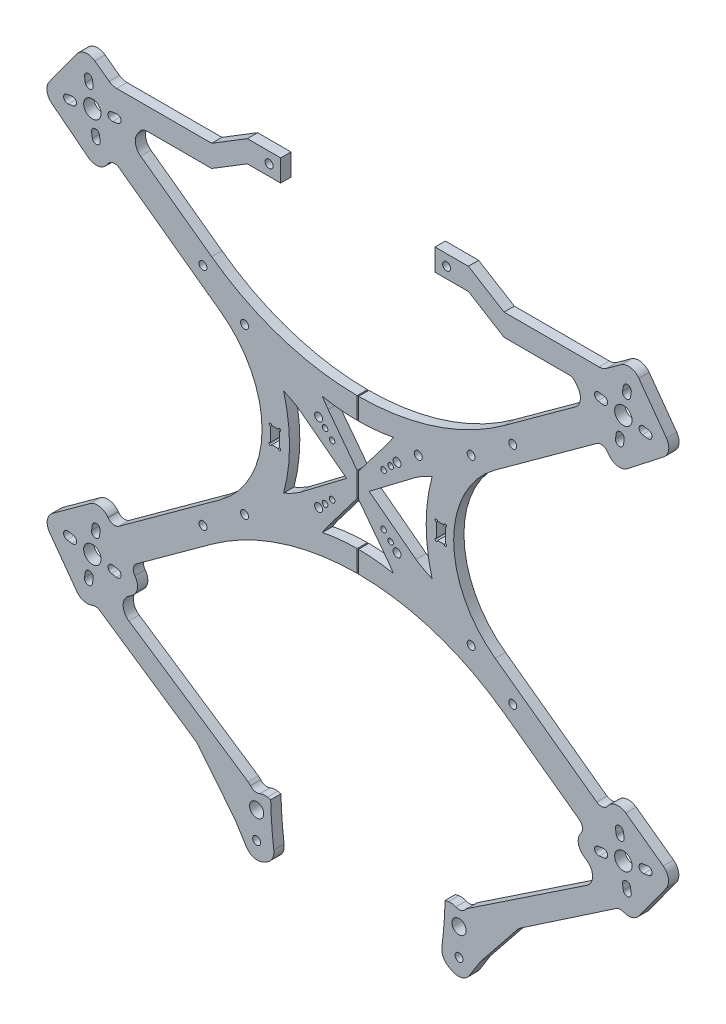
from build123d import *

# Parameters (mm, degrees)
SKETCH_7_R                   = 1.075
SKETCH_7_R_2                 = 1.55
EXTRUDE_2_5_DEPTH            = 4
CUT_EXTRUDE_4384_DEPTH       = 96.56387573
SKETCH_4456_R                = 3.375
SKETCH_4456_R_2              = 1.55
SKETCH_4456_R_3              = 2.75
EXTRUDE_8771_DEPTH           = 4
SKETCH_6862_R                = 1.55
SKETCH_6862_R_2              = 3.375
EXTRUDE_8910_DEPTH           = 4
SKETCH_8_W                   = 3.5
SKETCH_8_H                   = 6.5
CUT_EXTRUDE_3_DEPTH          = 192.931627997
PCB_2_R                      = 1.55
PCB_DEPTH                    = 192.931627997
FILLET_1_R                   = 5
FILLET_2_R                   = 3
SKETCH_11949_R               = 3.125
CUT_EXTRUDE_5_DEPTH          = 191.726245126
SKETCH_9_R                   = 0.5
CUT_EXTRUDE_12341_DEPTH      = 191.726245126
FILLET_12411_R               = 5
SPLIT_BODIES_1_OUTLINE_R     = 3.375
SPLIT_BODIES_1_OUTLINE_R_2   = 1.55
SPLIT_BODIES_1_OUTLINE_R_3   = 2.75
SPLIT_BODIES_1_OUTLINE_R_4   = 1.075
SPLIT_BODIES_1_DEPTH         = 4
SPLIT_BODIES_1_2_OUTLINE_R   = 3.375
SPLIT_BODIES_1_2_OUTLINE_R_2 = 1.55
SPLIT_BODIES_1_2_OUTLINE_R_3 = 2.75
SPLIT_BODIES_1_2_OUTLINE_R_4 = 1.075
SPLIT_BODIES_1_2_DEPTH       = 4


with BuildPart() as part:
    # 草图7 → 主结构-厚度还是得2.5, 不然铝柱不好选 (new body)
    with BuildSketch(Plane.XY):
        with BuildLine():
            Line((-67.360711622, -56.04781258), (-56.832820507, -48.398851956))
            ThreePointArc((-56.832820507, -48.398851956), (0, -29.93274918), (56.832820507, -48.398851956))
            Line((56.832820507, -48.398851956), (67.360711622, -56.04781258))
            ThreePointArc((67.360711622, -56.04781258), (75.39232454, -54.775730064), (74.120242023, -46.744117145))
            Line((74.120242023, -46.744117145), (53.395000648, -31.686347883))
            ThreePointArc((53.395000648, -31.686347883), (37.25, 0), (53.395000648, 31.686347883))
            Line((53.395000648, 31.686347883), (74.120242023, 46.744117145))
            ThreePointArc((74.120242023, 46.744117145), (75.39232454, 54.775730063), (67.360711622, 56.04781258))
            Line((67.360711622, 56.04781258), (56.832820507, 48.398851956))
            ThreePointArc((56.832820507, 48.398851956), (0, 29.93274918), (-56.832820507, 48.398851956))
            Line((-56.832820507, 48.398851956), (-67.360711622, 56.04781258))
            ThreePointArc((-67.360711622, 56.04781258), (-75.39232454, 54.775730063), (-74.120242023, 46.744117145))
            Line((-74.120242023, 46.744117145), (-53.395000648, 31.686347883))
            ThreePointArc((-53.395000648, 31.686347883), (-37.25, 0), (-53.395000648, -31.686347883))
            Line((-53.395000648, -31.686347883), (-74.120242023, -46.744117145))
            ThreePointArc((-74.120242023, -46.744117145), (-75.39232454, -54.775730064), (-67.360711622, -56.04781258))
        make_face()
        with Locations((10, 10)):
            Circle(SKETCH_7_R, mode=Mode.SUBTRACT)
        with Locations((12.75, 12.75)):
            Circle(SKETCH_7_R, mode=Mode.SUBTRACT)
        with Locations((15.25, 15.25)):
            Circle(SKETCH_7_R_2, mode=Mode.SUBTRACT)
        with Locations(Location((15.25, -15.25, 0), (0, 0, 180))):
            Circle(SKETCH_7_R_2, mode=Mode.SUBTRACT)
        with Locations(Location((12.75, -12.75, 0), (0, 0, 180))):
            Circle(SKETCH_7_R, mode=Mode.SUBTRACT)
        with Locations(Location((10, -10, 0), (0, 0, 180))):
            Circle(SKETCH_7_R, mode=Mode.SUBTRACT)
        with Locations(Location((60.224561343, 43.755705046, 0), (0, 0, 180))):
            Circle(SKETCH_7_R_2, mode=Mode.SUBTRACT)
        with Locations((-60.224561343, 43.755705046)):
            Circle(SKETCH_7_R_2, mode=Mode.SUBTRACT)
        with Locations((-10, -10)):
            Circle(SKETCH_7_R, mode=Mode.SUBTRACT)
        with Locations((-12.75, -12.75)):
            Circle(SKETCH_7_R, mode=Mode.SUBTRACT)
        with Locations((-15.25, -15.25)):
            Circle(SKETCH_7_R_2, mode=Mode.SUBTRACT)
        with Locations(Location((-15.25, 15.25, 0), (0, 0, 180))):
            Circle(SKETCH_7_R_2, mode=Mode.SUBTRACT)
        with Locations(Location((-12.75, 12.75, 0), (0, 0, 180))):
            Circle(SKETCH_7_R, mode=Mode.SUBTRACT)
        with Locations(Location((-10, 10, 0), (0, 0, 180))):
            Circle(SKETCH_7_R, mode=Mode.SUBTRACT)
        with Locations((60.224561343, -43.755705046)):
            Circle(SKETCH_7_R_2, mode=Mode.SUBTRACT)
        with Locations((44.044221455, -32)):
            Circle(SKETCH_7_R_2, mode=Mode.SUBTRACT)
        with Locations(Location((44.044221455, 32, 0), (0, 0, 180))):
            Circle(SKETCH_7_R_2, mode=Mode.SUBTRACT)
        with Locations((-44.044221455, 32)):
            Circle(SKETCH_7_R_2, mode=Mode.SUBTRACT)
        with Locations(Location((-60.224561343, -43.755705046, 0), (0, 0, 180))):
            Circle(SKETCH_7_R_2, mode=Mode.SUBTRACT)
        with Locations(Location((-44.044221455, -32, 0), (0, 0, 180))):
            Circle(SKETCH_7_R_2, mode=Mode.SUBTRACT)
    extrude(amount=EXTRUDE_2_5_DEPTH)

    # 草图6 → Cut-Extrude 4384 (cut, through all)
    with BuildSketch(Plane.XY):
        with BuildLine():
            Line((22.585858829, -13.811806674), (4.369879231, 0))
            Line((4.369879231, 0), (22.585858829, 13.811806674))
            ThreePointArc((22.585858829, 13.811806674), (25.637017076, 15.667901474), (28.86482634, 17.196267238))
            ThreePointArc((28.86482634, 17.196267238), (26.560773664, 0), (28.86482634, -17.196267238))
            ThreePointArc((28.86482634, -17.196267238), (25.637017076, -15.667901474), (22.585858829, -13.811806674))
        make_face()
        with BuildLine():
            Line((-22.585858829, 13.811806674), (-4.369879231, 0))
            Line((-4.369879231, 0), (-22.585858829, -13.811806674))
            ThreePointArc((-22.585858829, -13.811806674), (-25.637017076, -15.667901474), (-28.86482634, -17.196267238))
            ThreePointArc((-28.86482634, -17.196267238), (-26.560773664, 0), (-28.86482634, 17.196267238))
            ThreePointArc((-28.86482634, 17.196267238), (-25.637017076, 15.667901474), (-22.585858829, 13.811806674))
        make_face()
        with BuildLine():
            Line((-11.538849406, -19.588123327), (0, -4.369879231))
            Line((0, -4.369879231), (11.538849406, -19.588123327))
            ThreePointArc((11.538849406, -19.588123327), (12.705885919, -21.223769084), (13.776098615, -22.924344296))
            ThreePointArc((13.776098615, -22.924344296), (0, -21.563956437), (-13.776098615, -22.924344296))
            ThreePointArc((-13.776098615, -22.924344296), (-12.705885919, -21.223769084), (-11.538849406, -19.588123327))
        make_face()
        with BuildLine():
            Line((11.538849406, 19.588123327), (0, 4.369879231))
            Line((0, 4.369879231), (-11.538849406, 19.588123327))
            ThreePointArc((-11.538849406, 19.588123327), (-12.705885919, 21.223769084), (-13.776098615, 22.924344296))
            ThreePointArc((-13.776098615, 22.924344296), (0, 21.563956437), (13.776098615, 22.924344296))
            ThreePointArc((13.776098615, 22.924344296), (12.705885919, 21.223769084), (11.538849406, 19.588123327))
        make_face()
    extrude(amount=CUT_EXTRUDE_4384_DEPTH, mode=Mode.SUBTRACT)

    # Sketch 4456 → Extrude 8771 (add)
    # profile 1 of 2: a face of its own
    with BuildSketch(Plane.XY):
        with BuildLine():
            Line((41.719693225, -23.203740513), (95.282171315, -62.11915875))
            Line((95.282171315, -62.11915875), (100.131399646, -55.444768547))
            Line((100.131399646, -55.444768547), (122.783875489, -71.902755611))
            Line((122.783875489, -71.902755611), (106.325888424, -94.555231453))
            Line((106.325888424, -94.555231453), (101.962013194, -91.384690511))
            Line((101.962013194, -91.384690511), (62.537262972, -118.090865737))
            Line((62.537262972, -118.090865737), (47.651247851, -136.689513364))
            Line((47.651247851, -136.689513364), (40.869501648, -147.464808499))
            Line((40.869501648, -147.464808499), (35.510663468, -144.702808272))
            ThreePointArc((35.510663468, -144.702808272), (33.242094057, -142.452145099), (32.67537009, -139.307194251))
            ThreePointArc((32.67537009, -139.307194251), (33.501018596, -131.161165892), (33.898264993, -122.983044545))
            Line((33.898264993, -122.983044545), (42.671203749, -121.304684675))
            Line((42.671203749, -121.304684675), (94.999650503, -86.326237921))
            Line((94.999650503, -86.326237921), (83.673412582, -78.097244389))
            Line((83.673412582, -78.097244389), (88.522640913, -71.422854186))
            Line((88.522640913, -71.422854186), (34.960162823, -32.507435948))
            ThreePointArc((34.960162823, -32.507435948), (33.688080307, -24.47582303), (41.719693225, -23.203740513))
        make_face()
        with Locations(Location((103.228644035, -75, 0), (0, 0, 180))):
            Circle(SKETCH_4456_R, mode=Mode.SUBTRACT)
        with Locations((44.044221455, -32)):
            Circle(SKETCH_4456_R_2, mode=Mode.SUBTRACT)
        with Locations((60.224561343, -43.755705046)):
            Circle(SKETCH_4456_R_2, mode=Mode.SUBTRACT)
        with Locations(Location((39.335, -129.082300402, 0), (0, 0, 180))):
            Circle(SKETCH_4456_R_3, mode=Mode.SUBTRACT)
        with Locations(Location((39.335, -139.432300402, 0), (0, 0, 180))):
            Circle(SKETCH_4456_R_2, mode=Mode.SUBTRACT)
        with BuildLine():
            Line((110.640755254, -72.256715968), (112.616131935, -71.943847038))
            ThreePointArc((112.616131935, -71.943847038), (114.389522284, -73.232290545), (113.101078777, -75.005680894))
            Line((113.101078777, -75.005680894), (111.125702096, -75.318549824))
            ThreePointArc((111.125702096, -75.318549824), (109.352311747, -74.030106317), (110.640755254, -72.256715968))
        make_face(mode=Mode.SUBTRACT)
        with BuildLine():
            Line((103.547193859, -67.10294194), (103.234324929, -65.127565258))
            ThreePointArc((103.234324929, -65.127565258), (101.46093458, -63.839121751), (100.172491073, -65.6125121))
            Line((100.172491073, -65.6125121), (100.485360003, -67.587888781))
            ThreePointArc((100.485360003, -67.587888781), (102.258750352, -68.876332288), (103.547193859, -67.10294194))
        make_face(mode=Mode.SUBTRACT)
        with BuildLine():
            Line((95.816532817, -77.743284032), (93.841156135, -78.056152962))
            ThreePointArc((93.841156135, -78.056152962), (92.067765787, -76.767709455), (93.356209294, -74.994319106))
            Line((93.356209294, -74.994319106), (95.331585975, -74.681450176))
            ThreePointArc((95.331585975, -74.681450176), (97.104976324, -75.969893683), (95.816532817, -77.743284032))
        make_face(mode=Mode.SUBTRACT)
        with BuildLine():
            Line((102.910094211, -82.89705806), (103.222963142, -84.872434742))
            ThreePointArc((103.222963142, -84.872434742), (104.99635349, -86.160878249), (106.284796997, -84.3874879))
            Line((106.284796997, -84.3874879), (105.971928067, -82.412111219))
            ThreePointArc((105.971928067, -82.412111219), (104.198537719, -81.123667712), (102.910094211, -82.89705806))
        make_face(mode=Mode.SUBTRACT)
    # profile 2 of 2: a face of its own
    with BuildSketch(Plane.XY):
        with BuildLine():
            Line((-34.960162823, -32.507435948), (-88.522640913, -71.422854186))
            Line((-88.522640913, -71.422854186), (-83.673412582, -78.097244389))
            Line((-83.673412582, -78.097244389), (-94.999650503, -86.326237921))
            Line((-94.999650503, -86.326237921), (-42.671203749, -121.304684675))
            Line((-42.671203749, -121.304684675), (-33.898264993, -122.983044545))
            ThreePointArc((-33.898264993, -122.983044545), (-33.501018596, -131.161165892), (-32.67537009, -139.307194251))
            ThreePointArc((-32.67537009, -139.307194251), (-33.242094057, -142.452145099), (-35.510663468, -144.702808272))
            Line((-35.510663468, -144.702808272), (-40.869501648, -147.464808499))
            Line((-40.869501648, -147.464808499), (-47.651247851, -136.689513364))
            Line((-47.651247851, -136.689513364), (-62.537262972, -118.090865737))
            Line((-62.537262972, -118.090865737), (-101.962013194, -91.384690511))
            Line((-101.962013194, -91.384690511), (-106.325888424, -94.555231453))
            Line((-106.325888424, -94.555231453), (-122.783875489, -71.902755611))
            Line((-122.783875489, -71.902755611), (-100.131399646, -55.444768547))
            Line((-100.131399646, -55.444768547), (-95.282171315, -62.11915875))
            Line((-95.282171315, -62.11915875), (-41.719693225, -23.203740513))
            ThreePointArc((-41.719693225, -23.203740513), (-33.688080307, -24.47582303), (-34.960162823, -32.507435948))
        make_face()
        with Locations(Location((-44.044221455, -32, 0), (0, 0, 180.000000001))):
            Circle(SKETCH_4456_R_2, mode=Mode.SUBTRACT)
        with Locations(Location((-103.228644035, -75, 0), (0, 0, 180))):
            Circle(SKETCH_4456_R, mode=Mode.SUBTRACT)
        with Locations(Location((-39.335, -139.432300402, 0), (0, 0, 180))):
            Circle(SKETCH_4456_R_2, mode=Mode.SUBTRACT)
        with Locations(Location((-39.335, -129.082300402, 0), (0, 0, 180))):
            Circle(SKETCH_4456_R_3, mode=Mode.SUBTRACT)
        with Locations(Location((-60.224561343, -43.755705046, 0), (0, 0, 180.000000001))):
            Circle(SKETCH_4456_R_2, mode=Mode.SUBTRACT)
        with BuildLine():
            Line((-110.640755254, -72.256715968), (-112.616131935, -71.943847038))
            ThreePointArc((-112.616131935, -71.943847038), (-114.389522284, -73.232290545), (-113.101078777, -75.005680894))
            Line((-113.101078777, -75.005680894), (-111.125702096, -75.318549824))
            ThreePointArc((-111.125702096, -75.318549824), (-109.352311747, -74.030106317), (-110.640755254, -72.256715968))
        make_face(mode=Mode.SUBTRACT)
        with BuildLine():
            Line((-103.547193859, -67.10294194), (-103.234324929, -65.127565258))
            ThreePointArc((-103.234324929, -65.127565258), (-101.46093458, -63.839121751), (-100.172491073, -65.6125121))
            Line((-100.172491073, -65.6125121), (-100.485360003, -67.587888781))
            ThreePointArc((-100.485360003, -67.587888781), (-102.258750352, -68.876332288), (-103.547193859, -67.10294194))
        make_face(mode=Mode.SUBTRACT)
        with BuildLine():
            Line((-95.816532817, -77.743284032), (-93.841156135, -78.056152962))
            ThreePointArc((-93.841156135, -78.056152962), (-92.067765787, -76.767709455), (-93.356209294, -74.994319106))
            Line((-93.356209294, -74.994319106), (-95.331585975, -74.681450176))
            ThreePointArc((-95.331585975, -74.681450176), (-97.104976324, -75.969893683), (-95.816532817, -77.743284032))
        make_face(mode=Mode.SUBTRACT)
        with BuildLine():
            Line((-102.910094211, -82.89705806), (-103.222963142, -84.872434742))
            ThreePointArc((-103.222963142, -84.872434742), (-104.99635349, -86.160878249), (-106.284796997, -84.3874879))
            Line((-106.284796997, -84.3874879), (-105.971928067, -82.412111219))
            ThreePointArc((-105.971928067, -82.412111219), (-104.198537719, -81.123667712), (-102.910094211, -82.89705806))
        make_face(mode=Mode.SUBTRACT)
    extrude(amount=EXTRUDE_8771_DEPTH)

    # Sketch 6862 → Extrude 8910 (add)
    # profile 1 of 2: a face of its own
    with BuildSketch(Plane.XY):
        with BuildLine():
            Line((30, 95.097244389), (42.973762785, 95.097244389))
            Line((42.973762785, 95.097244389), (56.836706291, 86.597244389))
            Line((56.836706291, 86.597244389), (95.372658906, 86.597244389))
            Line((95.372658906, 86.597244389), (106.325888424, 94.555231453))
            Line((106.325888424, 94.555231453), (122.769420633, 71.892260587))
            Line((122.769420633, 71.892260587), (100.719184898, 54.635751552))
            Line((100.719184898, 54.635751552), (95.282171315, 62.11915875))
            Line((95.282171315, 62.11915875), (41.719693225, 23.203740513))
            ThreePointArc((41.719693225, 23.203740513), (33.688080307, 24.47582303), (34.960162823, 32.507435948))
            Line((34.960162823, 32.507435948), (88.522640913, 71.422854186))
            Line((88.522640913, 71.422854186), (83.673412582, 78.097244389))
            Line((83.673412582, 78.097244389), (56.836706291, 78.097244389))
            Line((56.836706291, 78.097244389), (42.973762785, 86.597244389))
            Line((42.973762785, 86.597244389), (30, 86.597244389))
            Line((30, 86.597244389), (30, 95.097244389))
        make_face()
        with Locations(Location((34.5, 90.85, 0), (0, 0, 180))):
            Circle(SKETCH_6862_R, mode=Mode.SUBTRACT)
        with Locations(Location((60.224561343, 43.755705046, 0), (0, 0, 180))):
            Circle(SKETCH_6862_R, mode=Mode.SUBTRACT)
        with Locations(Location((44.044221455, 32, 0), (0, 0, 180))):
            Circle(SKETCH_6862_R, mode=Mode.SUBTRACT)
        with Locations(Location((103.228644035, 75, 0), (0, 0, 180))):
            Circle(SKETCH_6862_R_2, mode=Mode.SUBTRACT)
        with BuildLine():
            Line((110.640755254, 72.256715968), (112.616131935, 71.943847038))
            ThreePointArc((112.616131935, 71.943847038), (114.389522284, 73.232290545), (113.101078777, 75.005680894))
            Line((113.101078777, 75.005680894), (111.125702096, 75.318549824))
            ThreePointArc((111.125702096, 75.318549824), (109.352311747, 74.030106317), (110.640755254, 72.256715968))
        make_face(mode=Mode.SUBTRACT)
        with BuildLine():
            Line((103.547193859, 67.10294194), (103.234324929, 65.127565258))
            ThreePointArc((103.234324929, 65.127565258), (101.46093458, 63.839121751), (100.172491073, 65.6125121))
            Line((100.172491073, 65.6125121), (100.485360003, 67.587888781))
            ThreePointArc((100.485360003, 67.587888781), (102.258750352, 68.876332288), (103.547193859, 67.10294194))
        make_face(mode=Mode.SUBTRACT)
        with BuildLine():
            Line((95.816532817, 77.743284032), (93.841156135, 78.056152962))
            ThreePointArc((93.841156135, 78.056152962), (92.067765787, 76.767709455), (93.356209294, 74.994319106))
            Line((93.356209294, 74.994319106), (95.331585975, 74.681450176))
            ThreePointArc((95.331585975, 74.681450176), (97.104976324, 75.969893683), (95.816532817, 77.743284032))
        make_face(mode=Mode.SUBTRACT)
        with BuildLine():
            Line((102.910094211, 82.89705806), (103.222963142, 84.872434742))
            ThreePointArc((103.222963142, 84.872434742), (104.99635349, 86.160878249), (106.284796997, 84.3874879))
            Line((106.284796997, 84.3874879), (105.971928067, 82.412111219))
            ThreePointArc((105.971928067, 82.412111219), (104.198537719, 81.123667712), (102.910094211, 82.89705806))
        make_face(mode=Mode.SUBTRACT)
    # profile 2 of 2: a face of its own
    with BuildSketch(Plane.XY):
        with BuildLine():
            Line((-41.719693225, 23.203740513), (-95.282171315, 62.11915875))
            Line((-95.282171315, 62.11915875), (-100.719184898, 54.635751552))
            Line((-100.719184898, 54.635751552), (-122.769420633, 71.892260587))
            Line((-122.769420633, 71.892260587), (-106.325888424, 94.555231453))
            Line((-106.325888424, 94.555231453), (-95.372658906, 86.597244389))
            Line((-95.372658906, 86.597244389), (-56.836706291, 86.597244389))
            Line((-56.836706291, 86.597244389), (-42.973762785, 95.097244389))
            Line((-42.973762785, 95.097244389), (-30, 95.097244389))
            Line((-30, 95.097244389), (-30, 86.597244389))
            Line((-30, 86.597244389), (-42.973762785, 86.597244389))
            Line((-42.973762785, 86.597244389), (-56.836706291, 78.097244389))
            Line((-56.836706291, 78.097244389), (-83.673412582, 78.097244389))
            Line((-83.673412582, 78.097244389), (-88.522640913, 71.422854186))
            Line((-88.522640913, 71.422854186), (-34.960162823, 32.507435948))
            ThreePointArc((-34.960162823, 32.507435948), (-33.688080307, 24.47582303), (-41.719693225, 23.203740513))
        make_face()
        with Locations(Location((-103.228644035, 75, 0), (0, 0, 180))):
            Circle(SKETCH_6862_R_2, mode=Mode.SUBTRACT)
        with Locations((-44.044221455, 32)):
            Circle(SKETCH_6862_R, mode=Mode.SUBTRACT)
        with Locations((-60.224561343, 43.755705046)):
            Circle(SKETCH_6862_R, mode=Mode.SUBTRACT)
        with Locations(Location((-34.5, 90.85, 0), (0, 0, 180))):
            Circle(SKETCH_6862_R, mode=Mode.SUBTRACT)
        with BuildLine():
            Line((-110.640755254, 72.256715968), (-112.616131935, 71.943847038))
            ThreePointArc((-112.616131935, 71.943847038), (-114.389522284, 73.232290545), (-113.101078777, 75.005680894))
            Line((-113.101078777, 75.005680894), (-111.125702096, 75.318549824))
            ThreePointArc((-111.125702096, 75.318549824), (-109.352311747, 74.030106317), (-110.640755254, 72.256715968))
        make_face(mode=Mode.SUBTRACT)
        with BuildLine():
            Line((-103.547193859, 67.10294194), (-103.234324929, 65.127565258))
            ThreePointArc((-103.234324929, 65.127565258), (-101.46093458, 63.839121751), (-100.172491073, 65.6125121))
            Line((-100.172491073, 65.6125121), (-100.485360003, 67.587888781))
            ThreePointArc((-100.485360003, 67.587888781), (-102.258750352, 68.876332288), (-103.547193859, 67.10294194))
        make_face(mode=Mode.SUBTRACT)
        with BuildLine():
            Line((-95.816532817, 77.743284032), (-93.841156135, 78.056152962))
            ThreePointArc((-93.841156135, 78.056152962), (-92.067765787, 76.767709455), (-93.356209294, 74.994319106))
            Line((-93.356209294, 74.994319106), (-95.331585975, 74.681450176))
            ThreePointArc((-95.331585975, 74.681450176), (-97.104976324, 75.969893683), (-95.816532817, 77.743284032))
        make_face(mode=Mode.SUBTRACT)
        with BuildLine():
            Line((-102.910094211, 82.89705806), (-103.222963142, 84.872434742))
            ThreePointArc((-103.222963142, 84.872434742), (-104.99635349, 86.160878249), (-106.284796997, 84.3874879))
            Line((-106.284796997, 84.3874879), (-105.971928067, 82.412111219))
            ThreePointArc((-105.971928067, 82.412111219), (-104.198537719, 81.123667712), (-102.910094211, 82.89705806))
        make_face(mode=Mode.SUBTRACT)
    extrude(amount=EXTRUDE_8910_DEPTH)

    # 草图8 → 切除-拉伸3 (cut, through all)
    with BuildSketch(Plane.XY):
        with Locations((32.25, 0)):
            Rectangle(SKETCH_8_W, SKETCH_8_H)
        with Locations((-32.25, 0)):
            Rectangle(SKETCH_8_W, SKETCH_8_H)
    extrude(amount=CUT_EXTRUDE_3_DEPTH, mode=Mode.SUBTRACT)

    # PCB 2 → PCB (cut, through all)
    with BuildSketch(Plane.XY):
        with Locations((23.5, 21.71275604)):
            Circle(PCB_2_R)
    extrude(amount=PCB_DEPTH, mode=Mode.SUBTRACT)

    # 电机座圆角-1
    fillet_1_edges = [part.edges().sort_by_distance(p)[0] for p in [
        (94.999650503, -86.326237921, 2),
        (83.673412582, -78.097244389, 2),
        (100.131399646, -55.444768547, 2),
        (122.783875489, -71.902755611, 2),
        (106.325888424, -94.555231453, 2),
        (-106.325888424, -94.555231453, 2),
        (-122.783875489, -71.902755611, 2),
        (-100.131399646, -55.444768547, 2),
        (-83.673412582, -78.097244389, 2),
        (-94.999650503, -86.326237921, 2),
        (-88.522640913, 71.422854186, 2),
        (-100.719184898, 54.635751552, 2),
        (-122.769420633, 71.892260587, 2),
        (-106.325888424, 94.555231453, 2),
        (-95.372658906, 86.597244389, 2),
        (88.522640913, 71.422854186, 2),
        (95.372658906, 86.597244389, 2),
        (106.325888424, 94.555231453, 2),
        (122.769420633, 71.892260587, 2),
        (100.719184898, 54.635751552, 2),
    ]]
    fillet(fillet_1_edges, radius=FILLET_1_R)

    # 电机座圆角-2
    fillet_2_edges = [part.edges().sort_by_distance(p)[0] for p in [
        (95.282171315, 62.11915875, 2),
        (83.673412582, 78.097244389, 2),
        (-83.673412582, 78.097244389, 2),
        (-95.282171315, 62.11915875, 2),
        (-88.522640913, -71.422854186, 2),
        (-95.282171315, -62.11915875, 2),
        (95.282171315, -62.11915875, 2),
        (88.522640913, -71.422854186, 2),
        (101.962013194, -91.384690511, 2),
        (-101.962013194, -91.384690511, 2),
    ]]
    fillet(fillet_2_edges, radius=FILLET_2_R)

    # Sketch 11949 → 切除-拉伸5 (cut, through all)
    with BuildSketch(Plane.XY):
        with Locations((39.335, -120.182300402)):
            Circle(SKETCH_11949_R)
        with Locations((-39.335, -120.182300402)):
            Circle(SKETCH_11949_R)
    extrude(amount=CUT_EXTRUDE_5_DEPTH, mode=Mode.SUBTRACT)

    # 草图9 → Cut-Extrude 12341 (cut, through all)
    with BuildSketch(Plane.XY.offset(4)):
        with Locations((-34, 3.25)):
            Circle(SKETCH_9_R)
        with Locations((-30.5, 3.25)):
            Circle(SKETCH_9_R)
        with Locations((-30.5, -3.25)):
            Circle(SKETCH_9_R)
        with Locations((-34, -3.25)):
            Circle(SKETCH_9_R)
        with Locations((34, -3.25)):
            Circle(SKETCH_9_R)
        with Locations((30.5, -3.25)):
            Circle(SKETCH_9_R)
        with Locations((30.5, 3.25)):
            Circle(SKETCH_9_R)
        with Locations((34, 3.25)):
            Circle(SKETCH_9_R)
    extrude(amount=-CUT_EXTRUDE_12341_DEPTH, mode=Mode.SUBTRACT)

    # Fillet 12411
    # the kernel refuses this fillet: 5 mm, written as the material it adds along each edge
    with BuildSketch(Plane(origin=(62.537262972, -118.090865737, 0), x_dir=(0.8279275993780559, 0.5608349937263982, 0), z_dir=(0, 0, 1)), Plane(origin=(-62.537262972, -118.090865737, 0), x_dir=(0.6248766859136476, -0.7807234641033767, 0), z_dir=(0, 0, 1))) as fillet_12411_piece_1:
        with BuildLine():
            CenterArc((FILLET_12411_R * 0.151354502876, -FILLET_12411_R), FILLET_12411_R, 90, 17.21330009)
            Line((-FILLET_12411_R * 0.144575288313, -FILLET_12411_R * 0.0447903064317), (0, 0))
            Line((0, 0), (FILLET_12411_R * 0.151354502876, 0))
        make_face()
    extrude(amount=4)
    with BuildSketch(Plane(origin=(47.651247851, -136.689513364, 0), x_dir=(0.6248766859136319, 0.7807234641033892, 0), z_dir=(0, 0, 1)), Plane(origin=(-47.651247851, -136.689513364, 0), x_dir=(0.5326614605326793, -0.8463284046179669, 0), z_dir=(0, 0, 1))) as fillet_12411_piece_2:
        with BuildLine():
            CenterArc((FILLET_12411_R * 0.0566762665368, -FILLET_12411_R), FILLET_12411_R, 90, 6.487681108)
            Line((-FILLET_12411_R * 0.0563133214739, -FILLET_12411_R * 0.00640382800599), (0, 0))
            Line((0, 0), (FILLET_12411_R * 0.0566762665369, 0))
        make_face()
    extrude(amount=4)
    # the kernel refuses this fillet: 5 mm, written as the material it takes off along each edge
    with BuildSketch(Plane(origin=(40.869501648, -147.464808499, -11.470523002), x_dir=(-0.8888809016376404, 0.4581383445028971, 0), z_dir=(0, 0, 1)), Plane(origin=(-40.869501648, -147.464808499, -11.470523002), x_dir=(-0.532661460532709, 0.846328404617948, 0), z_dir=(0, 0, 1))) as fillet_12411_2_piece_1:
        with BuildLine():
            CenterArc((FILLET_12411_R * 0.917641840184, -FILLET_12411_R), FILLET_12411_R, 90, 85.081587379)
            Line((-FILLET_12411_R * 0.0786759549038, -FILLET_12411_R * 0.914262894892), (0, 0))
            Line((0, 0), (FILLET_12411_R * 0.917641840184, 0))
        make_face()
    extrude(amount=26.941046005, mode=Mode.SUBTRACT)
    with BuildSketch(Plane(origin=(-37.103373722, -122.369871922, 8.875913591), x_dir=(0.982187532988923, -0.18790329970794328, 0), z_dir=(0, 0, -1))) as fillet_12411_2_piece_2:
        with BuildLine():
            CenterArc((1.950365437, 5), FILLET_12411_R, 235.916170221, 34.083829779)
            ThreePointArc((-0.851660934, 0.858907364), (-0.383877712, 0.47105249), (0, 0))
            Line((0, 0), (1.950365437, 0))
        make_face()
    extrude(amount=13.751827183, mode=Mode.SUBTRACT)
    with BuildSketch(Plane(origin=(-42.216499435, -121.391674622, 6.283952619), x_dir=(0.5176261480644923, -0.8556069020525234, 0), z_dir=(0, 0, -1))) as fillet_12411_2_piece_3:
        with BuildLine():
            CenterArc((1.644445885, 4.946295239), FILLET_12411_R, 246.992701284, 14.602089673)
            Line((-0.309796041, 0.344019878), (0, 0))
            ThreePointArc((0, 0), (0.456790524, 0.033565476), (0.913581047, 0))
        make_face()
    extrude(amount=8.567905237, mode=Mode.SUBTRACT)
    with BuildSketch(Plane(origin=(42.216499435, -121.391674622, 6.283952619), x_dir=(0.9821875329889277, 0.1879032997079196, 0), z_dir=(0, 0, -1))) as fillet_12411_2_piece_4:
        with BuildLine():
            CenterArc((2.575179825, 4.531940834), FILLET_12411_R, 230.408809917, 14.602089674)
            ThreePointArc((-0.611347707, 0.678884608), (-0.280731256, 0.361903559), (0, 0))
            Line((0, 0), (0.462950606, 0))
        make_face()
    extrude(amount=8.567905238, mode=Mode.SUBTRACT)
    with BuildSketch(Plane(origin=(37.103373722, -122.369871922, 8.875913591), x_dir=(0.8249924848100602, -0.5651436985465933, 0), z_dir=(0, 0, -1))) as fillet_12411_2_piece_5:
        with BuildLine():
            CenterArc((2.177217533, 4.905471348), FILLET_12411_R, 224.757281026, 34.083829779)
            Line((-1.373261993, 1.38494651), (0, 0))
            ThreePointArc((0, 0), (0.604782648, 0.059080407), (1.209565296, 0))
        make_face()
    extrude(amount=13.751827183, mode=Mode.SUBTRACT)

    # Split Bodies 1 2 outline → Split Bodies 1 2 (cut)
    with BuildSketch(Plane.XY):
        with BuildLine():
            ThreePointArc((-56.832820507, -48.398851956), (-29.759874798, -34.626533022), (0.25, -29.933072379))
            Line((0.25, -29.933072379), (0.25, -21.564400124))
            ThreePointArc((0.25, -21.564400124), (-6.797146311, -21.892704882), (-13.776098615, -22.924344296))
            ThreePointArc((-13.776098615, -22.924344296), (-12.705885919, -21.223769084), (-11.538849406, -19.588123327))
            Line((-11.538849406, -19.588123327), (0, -4.369879231))
            Line((0, -4.369879231), (0.25, -4.69959677))
            Line((0.25, -4.69959677), (0.25, 4.69959677))
            Line((0.25, 4.69959677), (0, 4.369879231))
            Line((0, 4.369879231), (-11.538849406, 19.588123327))
            ThreePointArc((-11.538849406, 19.588123327), (-12.705885919, 21.223769084), (-13.776098615, 22.924344296))
            ThreePointArc((-13.776098615, 22.924344296), (-6.797146311, 21.892704882), (0.25, 21.564400124))
            Line((0.25, 21.564400124), (0.25, 29.933072379))
            ThreePointArc((0.25, 29.933072379), (-29.759874798, 34.626533022), (-56.832820507, 48.398851956))
            Line((-56.832820507, 48.398851956), (-84.477555942, 68.483927924))
            ThreePointArc((-84.477555942, 68.483927924), (-86.477071383, 71.746840571), (-85.583714652, 75.467939157))
            Line((-85.583714652, 75.467939157), (-84.571887217, 76.860600146))
            ThreePointArc((-84.571887217, 76.860600146), (-83.506807733, 77.770263962), (-82.144836234, 78.097244389))
            Line((-82.144836234, 78.097244389), (-56.836706291, 78.097244389))
            Line((-56.836706291, 78.097244389), (-42.973762785, 86.597244389))
            Line((-42.973762785, 86.597244389), (-30, 86.597244389))
            Line((-30, 86.597244389), (-30, 95.097244389))
            Line((-30, 95.097244389), (-42.973762785, 95.097244389))
            Line((-42.973762785, 95.097244389), (-56.836706291, 86.597244389))
            Line((-56.836706291, 86.597244389), (-93.748060425, 86.597244389))
            ThreePointArc((-93.748060425, 86.597244389), (-95.293145397, 86.841961808), (-96.686986686, 87.552159417))
            Line((-96.686986686, 87.552159417), (-102.278222003, 91.614429659))
            ThreePointArc((-102.278222003, 91.614429659), (-106.000895829, 92.507536639), (-109.264107348, 90.505689724))
            Line((-109.264107348, 90.505689724), (-119.937946256, 75.79468377))
            ThreePointArc((-119.937946256, 75.79468377), (-120.842389268, 72.162912749), (-118.972506644, 68.920796637))
            Line((-118.972506644, 68.920796637), (-104.799957692, 57.829363332))
            ThreePointArc((-104.799957692, 57.829363332), (-101.024591686, 56.815281756), (-97.67335325, 58.827979166))
            Line((-97.67335325, 58.827979166), (-97.045527072, 59.692107767))
            ThreePointArc((-97.045527072, 59.692107767), (-95.087779484, 60.891817032), (-92.855120332, 60.355802993))
            Line((-92.855120332, 60.355802993), (-53.395000648, 31.686347883))
            ThreePointArc((-53.395000648, 31.686347883), (-37.25, 0), (-53.395000648, -31.686347883))
            Line((-53.395000648, -31.686347883), (-92.855120332, -60.355802993))
            ThreePointArc((-92.855120332, -60.355802993), (-95.087779484, -60.891817032), (-97.045527072, -59.692107767))
            Line((-97.045527072, -59.692107767), (-97.192473385, -59.489853519))
            ThreePointArc((-97.192473385, -59.489853519), (-100.455386031, -57.490338077), (-104.176484618, -58.383694808))
            Line((-104.176484618, -58.383694808), (-118.738790517, -68.963829349))
            ThreePointArc((-118.738790517, -68.963829349), (-120.738305958, -72.226741996), (-119.844949227, -75.947840583))
            Line((-119.844949227, -75.947840583), (-109.264814686, -90.510146481))
            ThreePointArc((-109.264814686, -90.510146481), (-106.551058018, -92.390718632), (-103.256787526, -92.169791516))
            ThreePointArc((-103.256787526, -92.169791516), (-101.791539496, -91.942740448), (-100.396517233, -92.445151496))
            Line((-100.396517233, -92.445151496), (-63.163815823, -117.666441229))
            ThreePointArc((-63.163815823, -117.666441229), (-62.575896334, -118.132702687), (-62.064373471, -118.681695796))
            Line((-62.064373471, -118.681695796), (-47.828326239, -136.468270909))
            ThreePointArc((-47.828326239, -136.468270909), (-47.657786107, -136.694164895), (-47.500301536, -136.929347035))
            Line((-47.500301536, -136.929347035), (-43.313463863, -143.581676726))
            ThreePointArc((-43.313463863, -143.581676726), (-40.398977423, -145.741760468), (-36.791130117, -145.362773931))
            Line((-36.791130117, -145.362773931), (-35.510663468, -144.702808272))
            ThreePointArc((-35.510663468, -144.702808272), (-33.242094057, -142.452145099), (-32.67537009, -139.307194251))
            ThreePointArc((-32.67537009, -139.307194251), (-33.501018596, -131.161165892), (-33.898264993, -122.983044545))
            Line((-33.898264993, -122.983044545), (-35.187749106, -122.736352023))
            ThreePointArc((-35.187749106, -122.736352023), (-36.668257161, -122.676643037), (-38.101256002, -123.053450127))
            ThreePointArc((-38.101256002, -123.053450127), (-40.068977694, -123.219881964), (-41.743605997, -122.173340872))
            ThreePointArc((-41.743605997, -122.173340872), (-42.179694745, -121.70942241), (-42.671203749, -121.304684675))
            Line((-42.671203749, -121.304684675), (-89.036558216, -90.312209587))
            ThreePointArc((-89.036558216, -90.312209587), (-91.256999969, -86.253080414), (-89.196881168, -82.110279219))
            Line((-89.196881168, -82.110279219), (-87.718497554, -81.036170651))
            ThreePointArc((-87.718497554, -81.036170651), (-85.718982112, -77.773258004), (-86.612338843, -74.052159417))
            Line((-86.612338843, -74.052159417), (-86.759285157, -73.849905169))
            ThreePointArc((-86.759285157, -73.849905169), (-87.295299195, -71.617246017), (-86.09558993, -69.659498429))
            Line((-86.09558993, -69.659498429), (-56.832820507, -48.398851956))
        make_face()
        with BuildLine():
            ThreePointArc((-110.640755254, -72.256715968), (-109.352311747, -74.030106317), (-111.125702096, -75.318549824))
            Line((-111.125702096, -75.318549824), (-113.101078777, -75.005680894))
            ThreePointArc((-113.101078777, -75.005680894), (-114.389522284, -73.232290545), (-112.616131935, -71.943847038))
            Line((-112.616131935, -71.943847038), (-110.640755254, -72.256715968))
        make_face(mode=Mode.SUBTRACT)
        with BuildLine():
            Line((-102.910094211, -82.89705806), (-103.222963142, -84.872434742))
            ThreePointArc((-103.222963142, -84.872434742), (-104.996353491, -86.160878249), (-106.284796997, -84.3874879))
            Line((-106.284796997, -84.3874879), (-105.971928067, -82.412111219))
            ThreePointArc((-105.971928067, -82.412111219), (-104.198537719, -81.123667712), (-102.910094211, -82.89705806))
        make_face(mode=Mode.SUBTRACT)
        with Locations((-103.228644035, -75)):
            Circle(SPLIT_BODIES_1_2_OUTLINE_R, mode=Mode.SUBTRACT)
        with BuildLine():
            Line((-95.331585975, -74.681450176), (-93.356209294, -74.994319106))
            ThreePointArc((-93.356209294, -74.994319106), (-92.067765787, -76.767709454), (-93.841156135, -78.056152962))
            Line((-93.841156135, -78.056152962), (-95.816532817, -77.743284032))
            ThreePointArc((-95.816532817, -77.743284032), (-97.104976324, -75.969893683), (-95.331585975, -74.681450176))
        make_face(mode=Mode.SUBTRACT)
        with BuildLine():
            ThreePointArc((-100.485360003, -67.587888781), (-102.258750351, -68.876332288), (-103.547193859, -67.10294194))
            Line((-103.547193859, -67.10294194), (-103.234324929, -65.127565258))
            ThreePointArc((-103.234324929, -65.127565258), (-101.46093458, -63.839121751), (-100.172491073, -65.6125121))
            Line((-100.172491073, -65.6125121), (-100.485360003, -67.587888781))
        make_face(mode=Mode.SUBTRACT)
        with Locations((-39.335, -139.432300402)):
            Circle(SPLIT_BODIES_1_2_OUTLINE_R_2, mode=Mode.SUBTRACT)
        with Locations((-39.335, -129.082300402)):
            Circle(SPLIT_BODIES_1_2_OUTLINE_R_3, mode=Mode.SUBTRACT)
        with Locations((-60.224561343, -43.755705046)):
            Circle(SPLIT_BODIES_1_2_OUTLINE_R_2, mode=Mode.SUBTRACT)
        with Locations((-44.044221455, -32)):
            Circle(SPLIT_BODIES_1_2_OUTLINE_R_2, mode=Mode.SUBTRACT)
        with BuildLine():
            ThreePointArc((-111.125702096, 75.318549824), (-109.352311747, 74.030106317), (-110.640755254, 72.256715968))
            Line((-110.640755254, 72.256715968), (-112.616131935, 71.943847038))
            ThreePointArc((-112.616131935, 71.943847038), (-114.389522284, 73.232290545), (-113.101078777, 75.005680894))
            Line((-113.101078777, 75.005680894), (-111.125702096, 75.318549824))
        make_face(mode=Mode.SUBTRACT)
        with BuildLine():
            ThreePointArc((-103.547193859, 67.10294194), (-102.258750351, 68.876332288), (-100.485360003, 67.587888781))
            Line((-100.485360003, 67.587888781), (-100.172491073, 65.6125121))
            ThreePointArc((-100.172491073, 65.6125121), (-101.46093458, 63.839121751), (-103.234324929, 65.127565258))
            Line((-103.234324929, 65.127565258), (-103.547193859, 67.10294194))
        make_face(mode=Mode.SUBTRACT)
        with Locations((-103.228644035, 75)):
            Circle(SPLIT_BODIES_1_2_OUTLINE_R, mode=Mode.SUBTRACT)
        with BuildLine():
            Line((-95.816532817, 77.743284032), (-93.841156135, 78.056152962))
            ThreePointArc((-93.841156135, 78.056152962), (-92.067765787, 76.767709454), (-93.356209294, 74.994319106))
            Line((-93.356209294, 74.994319106), (-95.331585975, 74.681450176))
            ThreePointArc((-95.331585975, 74.681450176), (-97.104976324, 75.969893683), (-95.816532817, 77.743284032))
        make_face(mode=Mode.SUBTRACT)
        with BuildLine():
            Line((-105.971928067, 82.412111219), (-106.284796997, 84.3874879))
            ThreePointArc((-106.284796997, 84.3874879), (-104.996353491, 86.160878249), (-103.222963142, 84.872434742))
            Line((-103.222963142, 84.872434742), (-102.910094211, 82.89705806))
            ThreePointArc((-102.910094211, 82.89705806), (-104.198537719, 81.123667712), (-105.971928067, 82.412111219))
        make_face(mode=Mode.SUBTRACT)
        with BuildLine():
            ThreePointArc((-34, 2.75), (-34.353553391, 3.603553391), (-33.5, 3.25))
            Line((-33.5, 3.25), (-31, 3.25))
            ThreePointArc((-31, 3.25), (-30.146446609, 3.603553391), (-30.5, 2.75))
            Line((-30.5, 2.75), (-30.5, -2.75))
            ThreePointArc((-30.5, -2.75), (-30.146446609, -3.603553391), (-31, -3.25))
            Line((-31, -3.25), (-33.5, -3.25))
            ThreePointArc((-33.5, -3.25), (-34.353553391, -3.603553391), (-34, -2.75))
            Line((-34, -2.75), (-34, 2.75))
        make_face(mode=Mode.SUBTRACT)
        with Locations((-44.044221455, 32)):
            Circle(SPLIT_BODIES_1_2_OUTLINE_R_2, mode=Mode.SUBTRACT)
        with Locations((-15.25, -15.25)):
            Circle(SPLIT_BODIES_1_2_OUTLINE_R_2, mode=Mode.SUBTRACT)
        with BuildLine():
            Line((-22.585858829, 13.811806674), (-4.369879231, 0))
            Line((-4.369879231, 0), (-22.585858829, -13.811806674))
            ThreePointArc((-22.585858829, -13.811806674), (-25.637017076, -15.667901474), (-28.86482634, -17.196267238))
            ThreePointArc((-28.86482634, -17.196267238), (-26.560773664, 0), (-28.86482634, 17.196267238))
            ThreePointArc((-28.86482634, 17.196267238), (-25.637017076, 15.667901474), (-22.585858829, 13.811806674))
        make_face(mode=Mode.SUBTRACT)
        with Locations((-12.75, -12.75)):
            Circle(SPLIT_BODIES_1_2_OUTLINE_R_4, mode=Mode.SUBTRACT)
        with Locations((-10, -10)):
            Circle(SPLIT_BODIES_1_2_OUTLINE_R_4, mode=Mode.SUBTRACT)
        with Locations((-15.25, 15.25)):
            Circle(SPLIT_BODIES_1_2_OUTLINE_R_2, mode=Mode.SUBTRACT)
        with Locations((-10, 10)):
            Circle(SPLIT_BODIES_1_2_OUTLINE_R_4, mode=Mode.SUBTRACT)
        with Locations((-12.75, 12.75)):
            Circle(SPLIT_BODIES_1_2_OUTLINE_R_4, mode=Mode.SUBTRACT)
        with Locations((-60.224561343, 43.755705046)):
            Circle(SPLIT_BODIES_1_2_OUTLINE_R_2, mode=Mode.SUBTRACT)
        with Locations((-34.5, 90.85)):
            Circle(SPLIT_BODIES_1_2_OUTLINE_R_2, mode=Mode.SUBTRACT)
    extrude(amount=SPLIT_BODIES_1_2_DEPTH, mode=Mode.SUBTRACT)


with BuildPart() as body_2:
    # Split Bodies 1: read off the stored shape, not the designer's step
    # Split Bodies 1 outline → Split Bodies 1 (new body)
    with BuildSketch(Plane.XY):
        with BuildLine():
            ThreePointArc((-56.832820507, -48.398851956), (-29.997639125, -34.703787336), (-0.25, -29.93307238))
            Line((-0.25, -29.93307238), (-0.25, -21.564400124))
            ThreePointArc((-0.25, -21.564400124), (-7.045936604, -21.917272889), (-13.776098615, -22.924344296))
            ThreePointArc((-13.776098615, -22.924344296), (-12.705885919, -21.223769084), (-11.538849406, -19.588123327))
            Line((-11.538849406, -19.588123327), (-0.25, -4.69959677))
            Line((-0.25, -4.69959677), (-0.25, 4.69959677))
            Line((-0.25, 4.69959677), (-11.538849406, 19.588123327))
            ThreePointArc((-11.538849406, 19.588123327), (-12.705885919, 21.223769084), (-13.776098615, 22.924344296))
            ThreePointArc((-13.776098615, 22.924344296), (-7.045936604, 21.917272889), (-0.25, 21.564400124))
            Line((-0.25, 21.564400124), (-0.25, 29.933072379))
            ThreePointArc((-0.25, 29.933072379), (-29.997639125, 34.703787336), (-56.832820507, 48.398851956))
            Line((-56.832820507, 48.398851956), (-84.477555942, 68.483927924))
            ThreePointArc((-84.477555942, 68.483927924), (-86.477071383, 71.746840571), (-85.583714652, 75.467939157))
            Line((-85.583714652, 75.467939157), (-84.571887217, 76.860600146))
            ThreePointArc((-84.571887217, 76.860600146), (-83.506807733, 77.770263962), (-82.144836234, 78.097244389))
            Line((-82.144836234, 78.097244389), (-56.836706291, 78.097244389))
            Line((-56.836706291, 78.097244389), (-42.973762785, 86.597244389))
            Line((-42.973762785, 86.597244389), (-30, 86.597244389))
            Line((-30, 86.597244389), (-30, 95.097244389))
            Line((-30, 95.097244389), (-42.973762785, 95.097244389))
            Line((-42.973762785, 95.097244389), (-56.836706291, 86.597244389))
            Line((-56.836706291, 86.597244389), (-93.748060425, 86.597244389))
            ThreePointArc((-93.748060425, 86.597244389), (-95.293145397, 86.841961808), (-96.686986686, 87.552159417))
            Line((-96.686986686, 87.552159417), (-102.278222003, 91.614429659))
            ThreePointArc((-102.278222003, 91.614429659), (-106.000895829, 92.507536639), (-109.264107348, 90.505689724))
            Line((-109.264107348, 90.505689724), (-119.937946256, 75.79468377))
            ThreePointArc((-119.937946256, 75.79468377), (-120.842389268, 72.162912749), (-118.972506644, 68.920796637))
            Line((-118.972506644, 68.920796637), (-104.799957692, 57.829363332))
            ThreePointArc((-104.799957692, 57.829363332), (-101.024591686, 56.815281756), (-97.67335325, 58.827979166))
            Line((-97.67335325, 58.827979166), (-97.045527072, 59.692107767))
            ThreePointArc((-97.045527072, 59.692107767), (-95.087779484, 60.891817032), (-92.855120332, 60.355802993))
            Line((-92.855120332, 60.355802993), (-53.395000648, 31.686347883))
            ThreePointArc((-53.395000648, 31.686347883), (-37.25, 0), (-53.395000648, -31.686347883))
            Line((-53.395000648, -31.686347883), (-92.855120332, -60.355802993))
            ThreePointArc((-92.855120332, -60.355802993), (-95.087779484, -60.891817032), (-97.045527072, -59.692107767))
            Line((-97.045527072, -59.692107767), (-97.192473385, -59.489853519))
            ThreePointArc((-97.192473385, -59.489853519), (-100.455386031, -57.490338077), (-104.176484618, -58.383694808))
            Line((-104.176484618, -58.383694808), (-118.738790517, -68.963829349))
            ThreePointArc((-118.738790517, -68.963829349), (-120.738305958, -72.226741996), (-119.844949227, -75.947840583))
            Line((-119.844949227, -75.947840583), (-109.264814686, -90.510146481))
            ThreePointArc((-109.264814686, -90.510146481), (-106.551058018, -92.390718632), (-103.256787526, -92.169791516))
            ThreePointArc((-103.256787526, -92.169791516), (-101.791539496, -91.942740448), (-100.396517233, -92.445151496))
            Line((-100.396517233, -92.445151496), (-63.163815823, -117.666441229))
            ThreePointArc((-63.163815823, -117.666441229), (-62.575896334, -118.132702687), (-62.064373471, -118.681695796))
            Line((-62.064373471, -118.681695796), (-47.828326239, -136.468270909))
            ThreePointArc((-47.828326239, -136.468270909), (-47.657786107, -136.694164895), (-47.500301536, -136.929347035))
            Line((-47.500301536, -136.929347035), (-43.313463863, -143.581676726))
            ThreePointArc((-43.313463863, -143.581676726), (-40.398977423, -145.741760468), (-36.791130117, -145.362773931))
            Line((-36.791130117, -145.362773931), (-35.510663468, -144.702808272))
            ThreePointArc((-35.510663468, -144.702808272), (-33.242094057, -142.452145099), (-32.67537009, -139.307194251))
            ThreePointArc((-32.67537009, -139.307194251), (-33.501018596, -131.161165892), (-33.898264993, -122.983044545))
            Line((-33.898264993, -122.983044545), (-35.187749106, -122.736352023))
            ThreePointArc((-35.187749106, -122.736352023), (-36.668257161, -122.676643037), (-38.101256002, -123.053450127))
            ThreePointArc((-38.101256002, -123.053450127), (-40.068977694, -123.219881964), (-41.743605997, -122.173340872))
            ThreePointArc((-41.743605997, -122.173340872), (-42.179694745, -121.70942241), (-42.671203749, -121.304684675))
            Line((-42.671203749, -121.304684675), (-89.036558216, -90.312209587))
            ThreePointArc((-89.036558216, -90.312209587), (-91.256999969, -86.253080414), (-89.196881168, -82.110279219))
            Line((-89.196881168, -82.110279219), (-87.718497554, -81.036170651))
            ThreePointArc((-87.718497554, -81.036170651), (-85.718982112, -77.773258004), (-86.612338843, -74.052159417))
            Line((-86.612338843, -74.052159417), (-86.759285157, -73.849905169))
            ThreePointArc((-86.759285157, -73.849905169), (-87.295299195, -71.617246017), (-86.09558993, -69.659498429))
            Line((-86.09558993, -69.659498429), (-56.832820507, -48.398851956))
        make_face()
        with BuildLine():
            ThreePointArc((-113.101078777, -75.005680894), (-114.389522284, -73.232290545), (-112.616131935, -71.943847038))
            Line((-112.616131935, -71.943847038), (-110.640755254, -72.256715968))
            ThreePointArc((-110.640755254, -72.256715968), (-109.352311747, -74.030106317), (-111.125702096, -75.318549824))
            Line((-111.125702096, -75.318549824), (-113.101078777, -75.005680894))
        make_face(mode=Mode.SUBTRACT)
        with BuildLine():
            ThreePointArc((-103.222963142, -84.872434742), (-104.996353491, -86.160878249), (-106.284796997, -84.3874879))
            Line((-106.284796997, -84.3874879), (-105.971928067, -82.412111219))
            ThreePointArc((-105.971928067, -82.412111219), (-104.198537719, -81.123667712), (-102.910094211, -82.89705806))
            Line((-102.910094211, -82.89705806), (-103.222963142, -84.872434742))
        make_face(mode=Mode.SUBTRACT)
        with Locations((-103.228644035, -75)):
            Circle(SPLIT_BODIES_1_OUTLINE_R, mode=Mode.SUBTRACT)
        with BuildLine():
            ThreePointArc((-93.356209294, -74.994319106), (-92.067765787, -76.767709454), (-93.841156135, -78.056152962))
            Line((-93.841156135, -78.056152962), (-95.816532817, -77.743284032))
            ThreePointArc((-95.816532817, -77.743284032), (-97.104976324, -75.969893683), (-95.331585975, -74.681450176))
            Line((-95.331585975, -74.681450176), (-93.356209294, -74.994319106))
        make_face(mode=Mode.SUBTRACT)
        with BuildLine():
            ThreePointArc((-103.234324929, -65.127565258), (-101.46093458, -63.839121751), (-100.172491073, -65.6125121))
            Line((-100.172491073, -65.6125121), (-100.485360003, -67.587888781))
            ThreePointArc((-100.485360003, -67.587888781), (-102.258750351, -68.876332288), (-103.547193859, -67.10294194))
            Line((-103.547193859, -67.10294194), (-103.234324929, -65.127565258))
        make_face(mode=Mode.SUBTRACT)
        with Locations((-39.335, -139.432300402)):
            Circle(SPLIT_BODIES_1_OUTLINE_R_2, mode=Mode.SUBTRACT)
        with Locations((-39.335, -129.082300402)):
            Circle(SPLIT_BODIES_1_OUTLINE_R_3, mode=Mode.SUBTRACT)
        with Locations((-60.224561343, -43.755705046)):
            Circle(SPLIT_BODIES_1_OUTLINE_R_2, mode=Mode.SUBTRACT)
        with Locations((-44.044221455, -32)):
            Circle(SPLIT_BODIES_1_OUTLINE_R_2, mode=Mode.SUBTRACT)
        with BuildLine():
            ThreePointArc((-112.616131935, 71.943847038), (-114.389522284, 73.232290545), (-113.101078777, 75.005680894))
            Line((-113.101078777, 75.005680894), (-111.125702096, 75.318549824))
            ThreePointArc((-111.125702096, 75.318549824), (-109.352311747, 74.030106317), (-110.640755254, 72.256715968))
            Line((-110.640755254, 72.256715968), (-112.616131935, 71.943847038))
        make_face(mode=Mode.SUBTRACT)
        with BuildLine():
            ThreePointArc((-100.172491073, 65.6125121), (-101.46093458, 63.839121751), (-103.234324929, 65.127565258))
            Line((-103.234324929, 65.127565258), (-103.547193859, 67.10294194))
            ThreePointArc((-103.547193859, 67.10294194), (-102.258750351, 68.876332288), (-100.485360003, 67.587888781))
            Line((-100.485360003, 67.587888781), (-100.172491073, 65.6125121))
        make_face(mode=Mode.SUBTRACT)
        with Locations((-103.228644035, 75)):
            Circle(SPLIT_BODIES_1_OUTLINE_R, mode=Mode.SUBTRACT)
        with BuildLine():
            ThreePointArc((-93.841156135, 78.056152962), (-92.067765787, 76.767709454), (-93.356209294, 74.994319106))
            Line((-93.356209294, 74.994319106), (-95.331585975, 74.681450176))
            ThreePointArc((-95.331585975, 74.681450176), (-97.104976324, 75.969893683), (-95.816532817, 77.743284032))
            Line((-95.816532817, 77.743284032), (-93.841156135, 78.056152962))
        make_face(mode=Mode.SUBTRACT)
        with BuildLine():
            ThreePointArc((-106.284796997, 84.3874879), (-104.996353491, 86.160878249), (-103.222963142, 84.872434742))
            Line((-103.222963142, 84.872434742), (-102.910094211, 82.89705806))
            ThreePointArc((-102.910094211, 82.89705806), (-104.198537719, 81.123667712), (-105.971928067, 82.412111219))
            Line((-105.971928067, 82.412111219), (-106.284796997, 84.3874879))
        make_face(mode=Mode.SUBTRACT)
        with BuildLine():
            ThreePointArc((-33.5, -3.25), (-34.353553391, -3.603553391), (-34, -2.75))
            Line((-34, -2.75), (-34, 2.75))
            ThreePointArc((-34, 2.75), (-34.353553391, 3.603553391), (-33.5, 3.25))
            Line((-33.5, 3.25), (-31, 3.25))
            ThreePointArc((-31, 3.25), (-30.146446609, 3.603553391), (-30.5, 2.75))
            Line((-30.5, 2.75), (-30.5, -2.75))
            ThreePointArc((-30.5, -2.75), (-30.146446609, -3.603553391), (-31, -3.25))
            Line((-31, -3.25), (-33.5, -3.25))
        make_face(mode=Mode.SUBTRACT)
        with Locations((-44.044221455, 32)):
            Circle(SPLIT_BODIES_1_OUTLINE_R_2, mode=Mode.SUBTRACT)
        with BuildLine():
            Line((-22.585858829, 13.811806674), (-4.369879231, 0))
            Line((-4.369879231, 0), (-22.585858829, -13.811806674))
            ThreePointArc((-22.585858829, -13.811806674), (-25.637017076, -15.667901474), (-28.86482634, -17.196267238))
            ThreePointArc((-28.86482634, -17.196267238), (-26.560773664, 0), (-28.86482634, 17.196267238))
            ThreePointArc((-28.86482634, 17.196267238), (-25.637017076, 15.667901474), (-22.585858829, 13.811806674))
        make_face(mode=Mode.SUBTRACT)
        with Locations((-15.25, -15.25)):
            Circle(SPLIT_BODIES_1_OUTLINE_R_2, mode=Mode.SUBTRACT)
        with Locations((-12.75, -12.75)):
            Circle(SPLIT_BODIES_1_OUTLINE_R_4, mode=Mode.SUBTRACT)
        with Locations((-10, -10)):
            Circle(SPLIT_BODIES_1_OUTLINE_R_4, mode=Mode.SUBTRACT)
        with Locations((-10, 10)):
            Circle(SPLIT_BODIES_1_OUTLINE_R_4, mode=Mode.SUBTRACT)
        with Locations((-15.25, 15.25)):
            Circle(SPLIT_BODIES_1_OUTLINE_R_2, mode=Mode.SUBTRACT)
        with Locations((-12.75, 12.75)):
            Circle(SPLIT_BODIES_1_OUTLINE_R_4, mode=Mode.SUBTRACT)
        with Locations((-60.224561343, 43.755705046)):
            Circle(SPLIT_BODIES_1_OUTLINE_R_2, mode=Mode.SUBTRACT)
        with Locations((-34.5, 90.85)):
            Circle(SPLIT_BODIES_1_OUTLINE_R_2, mode=Mode.SUBTRACT)
    extrude(amount=SPLIT_BODIES_1_DEPTH)


solid = Compound([part.part, body_2.part])
